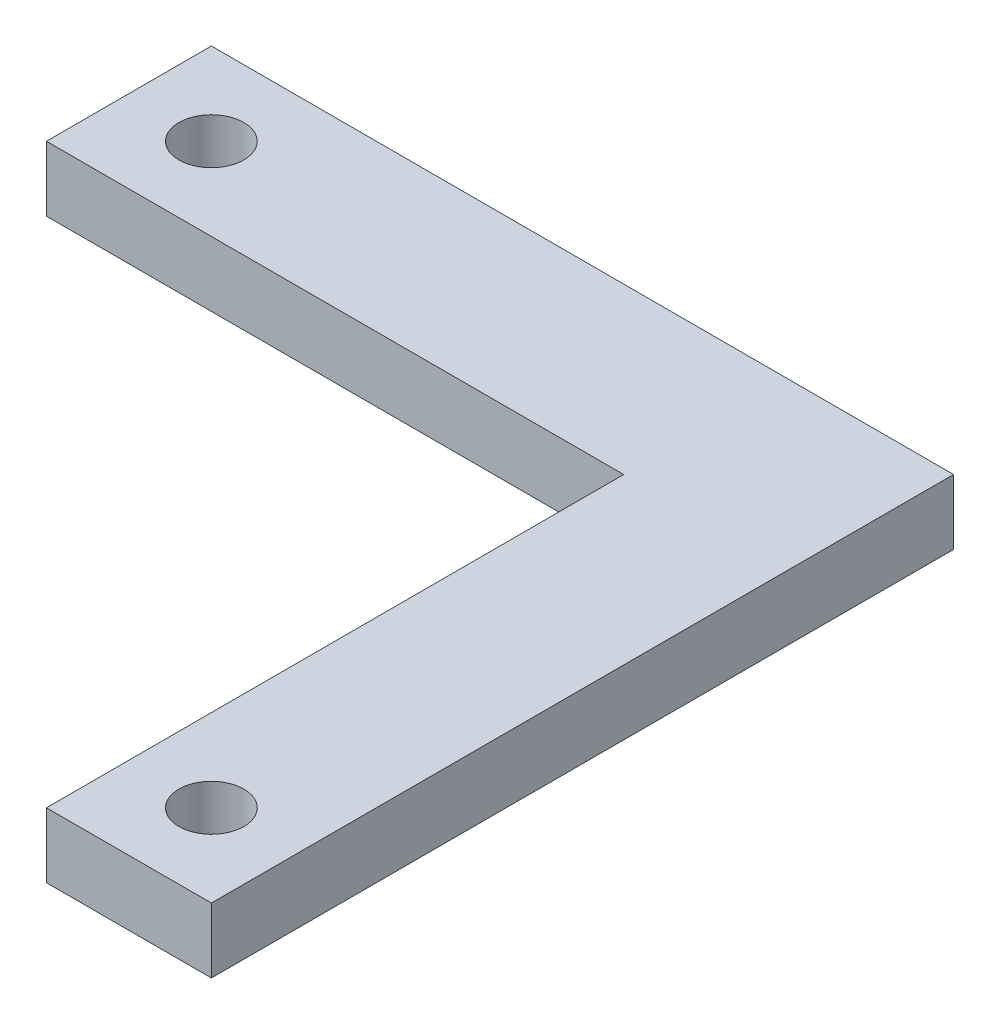
from build123d import *

# Parameters (mm, degrees)
BOSS_EXTRUDE1_DEPTH = 5


with BuildPart() as part:
    # Sketch1 → Boss-Extrude1 (new body)
    with BuildSketch(Plane(origin=(0, 0, 0), x_dir=(1, 0, 0), z_dir=(0, 1, 0))):
        Polygon((0, 12.7), (0, 6.35), (0, 0), (44.45, 0), (44.45, -44.45), (50.8, -44.45), (57.15, -44.45), (57.15, 0), (57.15, 12.7), align=None)
        with BuildLine():
            ThreePointArc((53.3, -38.1), (52.567766953, -39.867766953), (50.8, -40.6))
            ThreePointArc((50.8, -40.6), (49.032233047, -36.332233047), (53.3, -38.1))
        make_face(mode=Mode.SUBTRACT)
        with BuildLine():
            ThreePointArc((8.85, 6.35), (6.35, 3.85), (3.85, 6.35))
            ThreePointArc((3.85, 6.35), (6.35, 8.85), (8.85, 6.35))
        make_face(mode=Mode.SUBTRACT)
    extrude(amount=BOSS_EXTRUDE1_DEPTH)


solid = part.part
